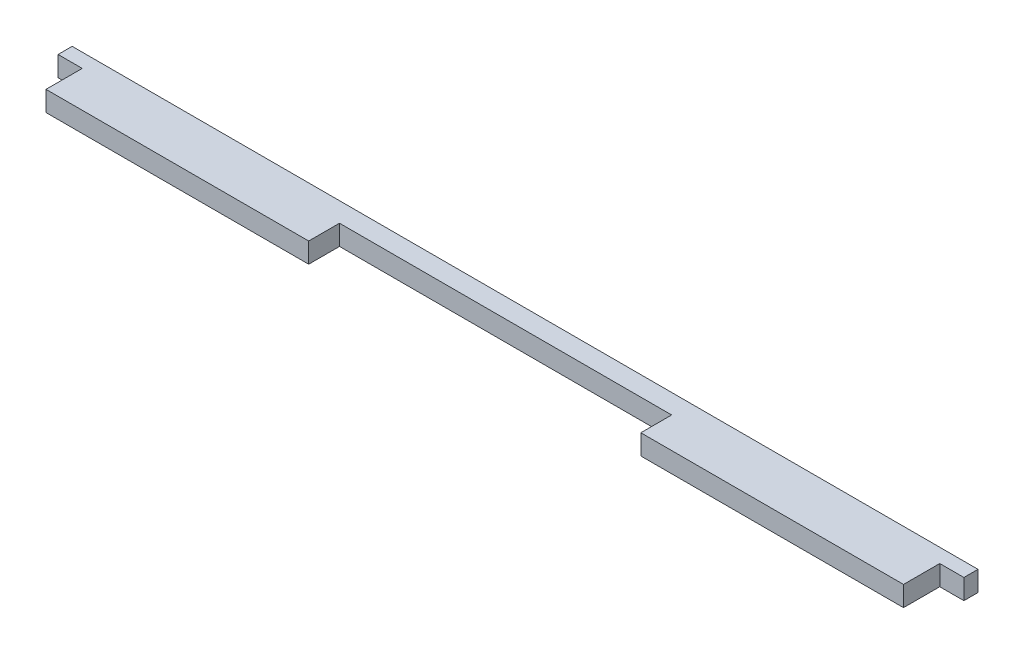
from build123d import *

# Parameters (mm, degrees)
BOSS_EXTRUDE1_DEPTH = 10
SKETCH3_W           = 12
SKETCH3_H           = 18
CUT_EXTRUDE1_DEPTH  = 10


with BuildPart() as part:
    # Sketch2 → Boss-Extrude1 (new body)
    with BuildSketch(Plane(origin=(0, 0, 0), x_dir=(1, 0, 0), z_dir=(0, 1, 0))):
        Polygon((0, 25), (0, 0), (142.5, 0), (142.5, 15.309556752), (307.5, 15.309556752), (307.5, 0), (450, 0), (450, 25), align=None)
    extrude(amount=BOSS_EXTRUDE1_DEPTH)

    # Sketch3 → Cut-Extrude1 (cut)
    with BuildSketch(Plane(origin=(0, 10, 0), x_dir=(1, 0, 0), z_dir=(0, 1, 0))):
        with Locations((6, 9)):
            Rectangle(SKETCH3_W, SKETCH3_H)
        with Locations((444, 9)):
            Rectangle(SKETCH3_W, SKETCH3_H)
    extrude(amount=-CUT_EXTRUDE1_DEPTH, mode=Mode.SUBTRACT)


solid = part.part
